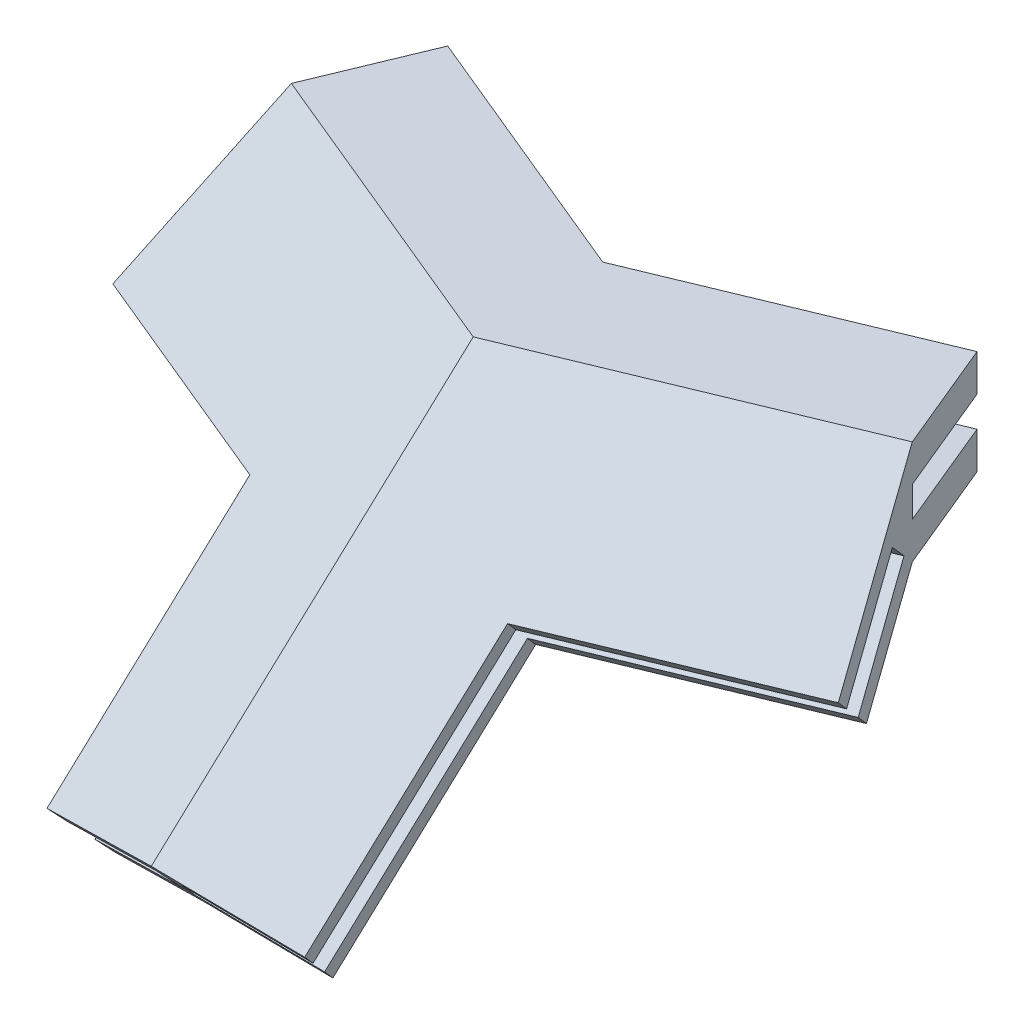
from build123d import *

# Parameters (mm, degrees)
SKETCH1_W                = 214.089522673
SKETCH1_H                = 271.033566845
BOSS_EXTRUDE1_DEPTH      = 10
SKETCH3_W                = 107.044761337
SKETCH3_H                = 271.033566845
CUT_EXTRUDE1_DEPTH       = 252.253590179
CUT_EXTRUDE2_DEPTH       = 249.55642867
BOSS_EXTRUDE3_DEPTH      = 40
CUT_EXTRUDE3_START       = -165.689856025
CUT_EXTRUDE3_DEPTH       = 205.862728092
CUT_EXTRUDE4_DEPTH       = 250.960593361
CUT_EXTRUDE5_DEPTH       = 250.960593361
CUT_EXTRUDE11_DEPTH      = 252.67545035
SKETCH26_W               = 104.148686
SKETCH26_H               = 11.3
BOSS_EXTRUDE7_DEPTH      = 45
CUT_EXTRUDE12_DEPTH      = 250.816831154
CUT_EXTRUDE13_DEPTH      = 252.67545035
CUT_EXTRUDE14_DEPTH      = 237.436663672
BOSS_EXTRUDE8_DEPTH      = 13.546139965
BOSS_EXTRUDE9_DEPTH      = 30
CUT_EXTRUDE16_DEPTH      = 184.540545695
CUT_EXTRUDE17_DEPTH      = 30
CUT_EXTRUDE17_DEPTH_BACK = 30


with BuildPart() as part:
    # Sketch1 → Boss-Extrude1 (new body)
    with BuildSketch(Plane(origin=(0, 0, 0), x_dir=(1, 0, 0), z_dir=(0, 1, 0))):
        with Locations((-3.148375333, -90.062114546)):
            Rectangle(SKETCH1_W, SKETCH1_H)
    extrude(amount=BOSS_EXTRUDE1_DEPTH)

    # Sketch3 → Cut-Extrude1 (cut, through all)
    with BuildSketch(Plane(origin=(0, 10, 0), x_dir=(1, 0, 0), z_dir=(0, 1, 0))):
        with Locations((-56.670756002, -90.062114546)):
            Rectangle(SKETCH3_W, SKETCH3_H)
    extrude(amount=-CUT_EXTRUDE1_DEPTH, mode=Mode.SUBTRACT)

    # Sketch4 → Cut-Extrude2 (cut, through all)
    with BuildSketch(Plane(origin=(0, 10, 0), x_dir=(1, 0, 0), z_dir=(0, 1, 0))):
        Polygon((103.896386003, -181.239506042), (100.834918545, -173.848469781), (9.996584241, 45.454668877), (103.896386003, 45.454668877), align=None)
    extrude(amount=-CUT_EXTRUDE2_DEPTH, mode=Mode.SUBTRACT)

    # Sketch6 → Boss-Extrude3 (add, along a direction that is not the sketch's normal)
    with BuildSketch(Plane(origin=(0, 10, 0), x_dir=(1, 0, 0), z_dir=(0, 1, 0))):
        Polygon((99.572063218, -170.799667324), (103.896386003, -181.239506042), (-3.148375333, -225.578897968), (-3.148375333, -213.347866105), align=None)
    extrude(amount=BOSS_EXTRUDE3_DEPTH, dir=(-0.2705980500730979, 0.7071067811865489, -0.6532814824381872))

    # Cut-Extrude3: read off the stored shape, not the designer's step
    # Cut-Extrude3 outline → Cut-Extrude3 (cut)
    with BuildSketch(Plane(origin=(0, 0, 0), x_dir=(1, 0, 0), z_dir=(0, 0.6785983445458481, -0.7345095552677544)).offset(CUT_EXTRUDE3_START)):
        Polygon((-3.148375333, -165), (-3.148375333, -152.122604304), (-13.972297336, -155.165042499), (-15, -155.45391393), (-15, -165), align=None)
    extrude(amount=CUT_EXTRUDE3_DEPTH, mode=Mode.SUBTRACT)

    # Sketch8 → Cut-Extrude4 (cut, through all)
    with BuildSketch(Plane(origin=(0, 10, 0), x_dir=(1, 0, 0), z_dir=(0, 1, 0))):
        Polygon((-3.148375333, -225.578897968), (103.896386003, -181.239506042), (103.896386003, -225.578897968), align=None)
    extrude(amount=-CUT_EXTRUDE4_DEPTH, mode=Mode.SUBTRACT)

    # Sketch9 → Cut-Extrude5 (cut, through all)
    with BuildSketch(Plane(origin=(0, 10, 0), x_dir=(1, 0, 0), z_dir=(0, 1, 0))):
        Polygon((-3.148375333, -213.347866105), (99.572063218, -170.799667324), (9.996584241, 45.454668877), (-3.148375333, 45.454668877), align=None)
    extrude(amount=-CUT_EXTRUDE5_DEPTH, mode=Mode.SUBTRACT)

    # Sketch25 → Cut-Extrude11 (cut, through all)
    with BuildSketch(Plane(origin=(24.603270673, 0, -10.191008392), x_dir=(-0.38268343236508967, 0, -0.9238795325112868), z_dir=(0.9238795325112867, 0, -0.3826834323650896))):
        Polygon((-178.918624473, 38.284271247), (-178.918624473, 26.984271247), (-167.618624473, 38.284271247), align=None)
    extrude(amount=-CUT_EXTRUDE11_DEPTH, mode=Mode.SUBTRACT)

    # Sketch26 → Boss-Extrude7 (add)
    with BuildSketch(Plane(origin=(68.469193327, 0, 165.299255136), x_dir=(-0.9238795325112868, 0, 0.3826834323650896), z_dir=(-0.38268343236508956, 0, -0.9238795325112867))):
        with Locations((25.443954722, 32.634271247)):
            Rectangle(SKETCH26_W, SKETCH26_H)
    extrude(amount=BOSS_EXTRUDE7_DEPTH)

    # Sketch27 → Cut-Extrude12 (cut, through all)
    with BuildSketch(Plane.XZ.offset(-26.984271247)):
        Polygon((-3.148375333, 194.964223379), (-3.148375333, 146.256574366), (-20.36912979, 153.389644416), align=None)
    extrude(amount=-CUT_EXTRUDE12_DEPTH, mode=Mode.SUBTRACT)

    # Sketch29 → Cut-Extrude13 (cut, through all)
    with BuildSketch(Plane(origin=(24.603270673, 0, -10.191008392), x_dir=(-0.38268343236508967, 0, -0.9238795325112868), z_dir=(0.9238795325112867, 0, -0.3826834323650896))):
        Polygon((-188.111012628, 17.791883092), (-189.772713564, 19.453584028), (-180.580325409, 28.645972183), (-182.906923537, 30.972570312), (-192.099311693, 21.780182156), (-193.761012628, 23.441883092), (-207.20289572, 10), (-207.20289572, 0), (-195.90289572, 0), (-195.90289572, 10), align=None)
    extrude(amount=-CUT_EXTRUDE13_DEPTH, mode=Mode.SUBTRACT)

    # Sketch31 → Cut-Extrude14 (cut, through all)
    with BuildSketch(Plane(origin=(24.603270673, 0, -10.191008392), x_dir=(-0.38268343236508967, 0, -0.9238795325112868), z_dir=(0.9238795325112867, 0, -0.3826834323650896))):
        Polygon((-133.918624473, 38.284271247), (-165.918624473, 38.284271247), (-165.918624473, 34.284271247), (-178.918624473, 34.284271247), (-178.918624473, 30.984271247), (-165.918624473, 30.984271247), (-165.918624473, 26.984271247), (-133.918624473, 26.984271247), align=None)
    extrude(amount=-CUT_EXTRUDE14_DEPTH, mode=Mode.SUBTRACT)

    # Sketch32 → Boss-Extrude8 (add, along a direction that is not the sketch's normal)
    with BuildSketch(Plane(origin=(29.071379893, -75.967176613, 70.184519615), x_dir=(-0.9626924198811577, -0.19875685341551308, 0.18362738881693294), z_dir=(0.27059805007309423, -0.7071067811865585, 0.6532814824381782))):
        Polygon((33.468379475, -163.963292106), (32.988537984, -163.822749787), (32.063683338, -166.980401064), (33.468379475, -167.391827037), align=None)
    extrude(amount=BOSS_EXTRUDE8_DEPTH, dir=(0, -0.6785983445458523, 0.7345095552677506))

    # Sketch33 → Boss-Extrude9 (add, along a direction that is not the sketch's normal)
    with BuildSketch(Plane(origin=(32.589154544, -85.159564768, 78.677178887), x_dir=(-0.962692419881157, -0.19875685341551325, 0.1836273888169371), z_dir=(0.2705980500730972, -0.7071067811865508, 0.6532814824381854))):
        Polygon((36.642638275, -164.893010983), (24.166759505, -161.238910693), (24.827308404, -158.983655684), (37.122479766, -162.584828001), (37.122479766, -170.910813534), (22.58135596, -166.651816978), (23.241904859, -164.39656197), (35.717783628, -168.05066226), align=None)
    extrude(amount=BOSS_EXTRUDE9_DEPTH, dir=(0, -0.6785983445458483, 0.7345095552677544))

    # Sketch35 → Cut-Extrude16 (cut, through all)
    with BuildSketch(Plane(origin=(39.397813434, 102.95144786, 95.11473552), x_dir=(-0.9626924198811563, 0.19875685341551394, 0.18362738881693996), z_dir=(-0.2705980500730996, -0.7071067811865461, -0.6532814824381894))):
        Polygon((31.899825803, -164.836570859), (46.839732684, -164.836570859), (46.839732684, -169.212368274), (44.194997165, -168.437743175), align=None)
    extrude(amount=-CUT_EXTRUDE16_DEPTH, mode=Mode.SUBTRACT)

    # Sketch37 → Cut-Extrude17 (cut, two sides: drawn at the far end of the back side and taken through both)
    with BuildSketch(Plane(origin=(68.469193327, 0, 165.299255136), x_dir=(-0.9238795325112868, 0, 0.3826834323650897), z_dir=(-0.38268343236508967, 0, -0.9238795325112867)).offset(-CUT_EXTRUDE17_DEPTH_BACK)):
        Polygon((41.018297722, 30.984271247), (41.018297722, 53.15222912), (-28.644246397, 53.15222912), (-28.644246397, 4.37720767), (41.018297722, 4.37720767), align=None)
    extrude(amount=CUT_EXTRUDE17_DEPTH + CUT_EXTRUDE17_DEPTH_BACK, mode=Mode.SUBTRACT)

    # Mirror2: part across plane


with BuildPart() as part_1:
    add(part.part)
    add(part.part.mirror(Plane(origin=(-3.148375333, 0, 225.578897968), x_dir=(0, 0, 1), z_dir=(1, 0, 0))))


solid = part_1.part
